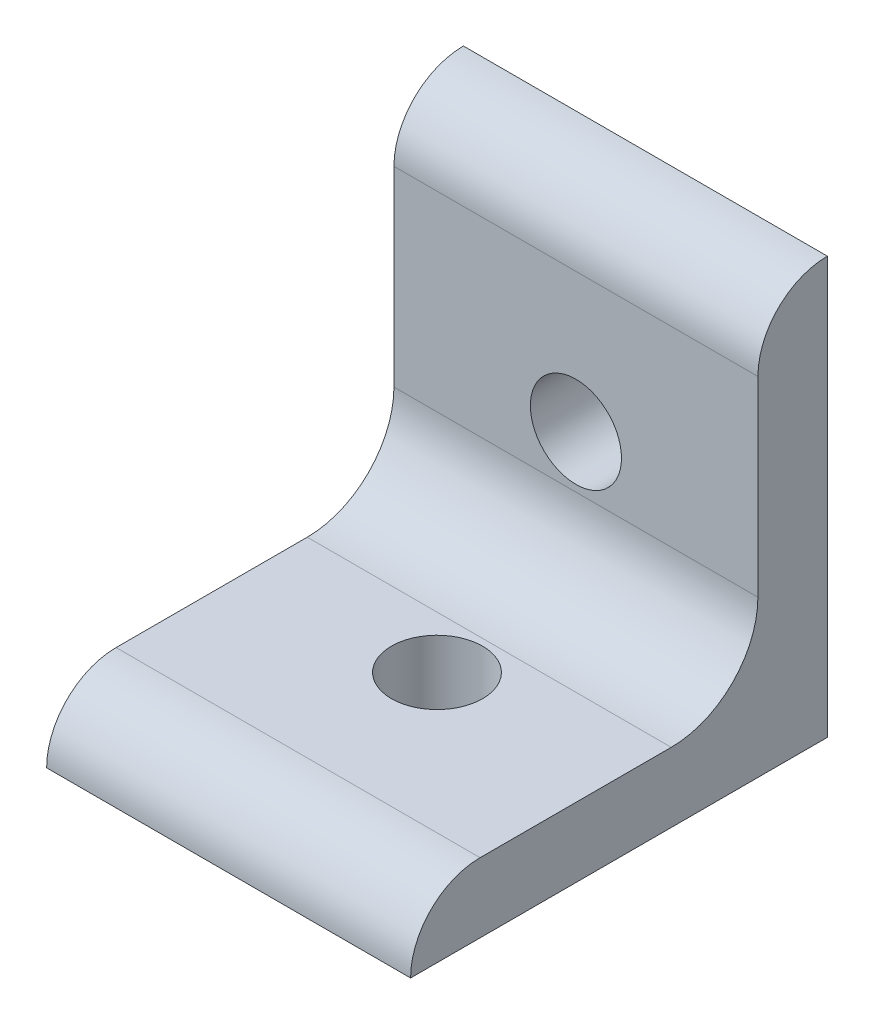
from build123d import *

# Parameters (mm, degrees)
BOSS_EXTRUDE1_DEPTH = 33.274
HOLE1_D             = 8.3312
HOLE2_D             = 8.3312
FILLET1_R           = 7.9248


with BuildPart() as part:
    # Sketch1 → Boss-Extrude1 (new body)
    with BuildSketch(Plane(origin=(16.637, 0, 0), x_dir=(0, 0, -1), z_dir=(1, 0, 0))):
        with BuildLine():
            Line((-38.1, 0), (0, 0))
            Line((0, 0), (0, 38.1))
            ThreePointArc((0, 38.1), (-4.490128061, 36.240128061), (-6.35, 31.75))
            Line((-6.35, 31.75), (-6.35, 6.35))
            Line((-6.35, 6.35), (-31.75, 6.35))
            ThreePointArc((-31.75, 6.35), (-36.240128061, 4.490128061), (-38.1, 0))
        make_face()
    extrude(amount=-BOSS_EXTRUDE1_DEPTH)

    # Hole1 (through all)
    with Locations(Plane.XY.offset(6.35)):
        with Locations((0, 19.05)):
            Hole(HOLE1_D / 2)

    # Hole2 (through all)
    with Locations(Plane(origin=(0, 6.35, 0), x_dir=(1, 0, 0), z_dir=(0, 1, 0))):
        with Locations((0, -19.05)):
            Hole(HOLE2_D / 2)

    # Fillet1
    fillet1_edges = [part.edges().sort_by_distance(p)[0] for p in [
        (0, 6.35, 6.35),
    ]]
    fillet(fillet1_edges, radius=FILLET1_R)


solid = part.part
